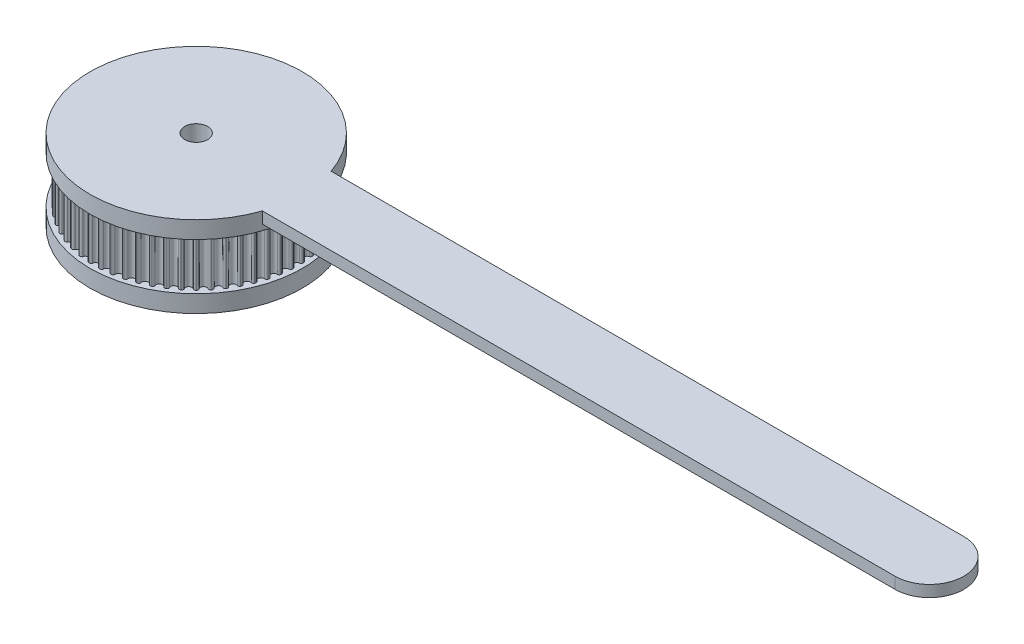
from build123d import *
from build123d.topology import SkipClean

# Parameters (mm, degrees)
BOSS_EXTRUDE1_DEPTH     = 6.499999954
CIRPATTERN1_COUNT       = 60
SKETCH2_W               = 29.441486473
SKETCH2_H               = 1.5875
BOSS_EXTRUDE4_DEPTH     = 3.175
BOSS_EXTRUDE5_START     = 3.175
SKETCH8_R               = 29.441486473
BOSS_EXTRUDE5_DEPTH     = 3.175
CUT_EXTRUDE1_DEPTH      = 216.930781436
CUT_EXTRUDE1_DEPTH_BACK = 216.930781436
SKETCH9_R               = 3.175


with BuildPart() as part:
    # Sketch1 → Boss-Extrude1 (new, symmetric)
    with BuildSketch(Plane(origin=(0, 0, 0), x_dir=(1, 0, 0), z_dir=(0, 1, 0))):
        with BuildLine():
            ThreePointArc((0.880356905, 27.806077591), (0.58129755, 27.262797831), (0, 27.046736373))
            ThreePointArc((0, 27.046736373), (-1.415516811, -27.009669761), (2.827153789, 26.898571521))
            ThreePointArc((2.827153789, 26.898571521), (2.271625221, 27.174211512), (2.030992343, 27.745775343))
            ThreePointArc((2.030992343, 27.745775343), (1.887213395, 28.075797443), (1.55902338, 28.223710545))
            ThreePointArc((1.55902338, 28.223710545), (1.479366683, 28.227997893), (1.399698205, 28.232060424))
            ThreePointArc((1.399698205, 28.232060424), (1.057844919, 28.119262803), (0.880356905, 27.806077591))
        make_face()
    boss_extrude1 = extrude(amount=BOSS_EXTRUDE1_DEPTH, both=True)

    # CirPattern1: Boss-Extrude1 ×60 about axis
    cirpattern1_axis = Axis((0, 3.3, 0), (0, -1, 0))
    for i in range(1, CIRPATTERN1_COUNT):
        add(boss_extrude1.rotate(cirpattern1_axis, i * 360 / CIRPATTERN1_COUNT))

    # Sketch2 → Revolve3 (revolve)
    with BuildSketch(Plane(origin=(0, 0, 0), x_dir=(0, 0, -1), z_dir=(1, 0, 0))):
        with Locations((14.720743237, 7.293749954)):
            Rectangle(SKETCH2_W, SKETCH2_H)
    revolve3 = revolve(axis=Axis((0, 3.3, 0), (0, -1, 0)))

    # Mirror1: Revolve3 across plane
    add(revolve3.mirror(Plane.ZX))

    # Sketch7 → Boss-Extrude4 (add)
    with SkipClean():  # the faces are left unmerged after this step: merging them gives an invalid solid
        with BuildSketch(Plane(origin=(0, 8.087499954, 0), x_dir=(1, 0, 0), z_dir=(0, 1, 0))):
            with BuildLine():
                Line((27.858131681, 9.525), (203.2, 9.525))
                ThreePointArc((203.2, 9.525), (212.725, 0), (203.2, -9.525))
                Line((203.2, -9.525), (27.858131681, -9.525))
                ThreePointArc((27.858131681, -9.525), (-29.441486473, 0), (27.858131681, 9.525))
            make_face()
        extrude(amount=BOSS_EXTRUDE4_DEPTH)

    # Sketch8 → Boss-Extrude5 (add)
    with SkipClean():  # the faces are left unmerged after this step: merging them gives an invalid solid
        with BuildSketch(Plane.XZ.offset(8.087499954).offset(BOSS_EXTRUDE5_START)):
            Circle(SKETCH8_R)
        extrude(amount=-BOSS_EXTRUDE5_DEPTH)

    # Sketch9 → Cut-Extrude1 (cut, two sides: drawn at the far end of the back side and taken through both)
    with SkipClean():  # the faces are left unmerged after this step: merging them gives an invalid solid
        with BuildSketch(Plane.XZ.offset(11.262499954).offset(-CUT_EXTRUDE1_DEPTH_BACK)):
            Circle(SKETCH9_R)
        extrude(amount=CUT_EXTRUDE1_DEPTH + CUT_EXTRUDE1_DEPTH_BACK, mode=Mode.SUBTRACT)


solid = part.part
